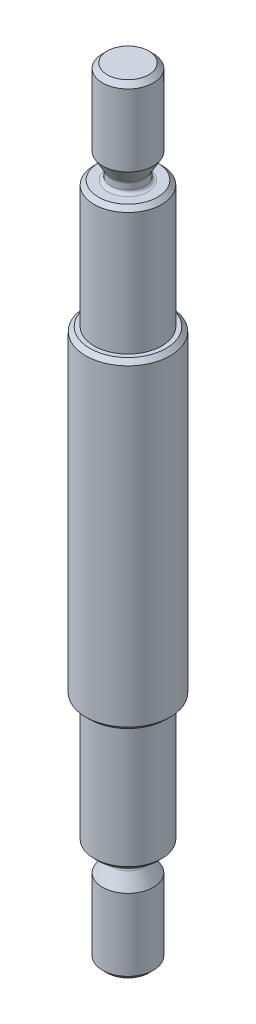
from build123d import *

# Parameters (mm, degrees)
SKETCH1_R           = 5
BOSS_EXTRUDE1_DEPTH = 19
SKETCH2_R           = 4
BOSS_EXTRUDE2_DEPTH = 15
BOSS_EXTRUDE3_START = -53
SKETCH2_2_R         = 4
BOSS_EXTRUDE3_DEPTH = 15
CHAMFER2_SIZE       = 0.5
SKETCH3_R           = 3.1
BOSS_EXTRUDE4_DEPTH = 12
CHAMFER3_SIZE       = 0.5


# Read off the part's stored shape, not the designer's step: M6 Machine Threads Stud1, M6 Machine Threads Stud2
with BuildPart() as part:
    # Sketch1 → Boss-Extrude1 (new, symmetric)
    with BuildSketch(Plane(origin=(0, 0, 0), x_dir=(1, 0, 0), z_dir=(0, 1, 0))):
        with Locations(Location((0, 0, 0), (0, 0, 270))):
            Circle(SKETCH1_R)
    extrude(amount=BOSS_EXTRUDE1_DEPTH, both=True)

    # Sketch2 → Boss-Extrude2 (add)
    with BuildSketch(Plane(origin=(0, 19, 0), x_dir=(1, 0, 0), z_dir=(0, 1, 0))):
        with Locations(Location((0, 0, 0), (0, 0, 270))):
            Circle(SKETCH2_R)
    extrude(amount=BOSS_EXTRUDE2_DEPTH)

    # Sketch2<2> → Boss-Extrude3 (add)
    with BuildSketch(Plane(origin=(0, 19, 0), x_dir=(1, 0, 0), z_dir=(0, 1, 0)).offset(BOSS_EXTRUDE3_START)):
        with Locations(Location((0, 0, 0), (0, 0, 270))):
            Circle(SKETCH2_2_R)
    extrude(amount=BOSS_EXTRUDE3_DEPTH)

    # Chamfer2
    chamfer2_edges = [part.edges().sort_by_distance(p)[0] for p in [
        (0, -19, -5),
        (0, 19, -5),
    ]]
    chamfer(chamfer2_edges, length=CHAMFER2_SIZE)

    # Sketch3 → Boss-Extrude4 (add)
    with BuildSketch(Plane(origin=(0, 34, 0), x_dir=(1, 0, 0), z_dir=(0, 1, 0))):
        with Locations(Location((0, 0, 0), (0, 0, 270))):
            Circle(SKETCH3_R)
    boss_extrude4 = extrude(amount=BOSS_EXTRUDE4_DEPTH)

    # M6 Machine Threads Stud1 outline → M6 Machine Threads Stud1 (revolve, cut)
    with BuildSketch(Plane.XY):
        with BuildLine():
            Line((3.1, 46), (2.4455, 46))
            Line((2.4455, 46), (3, 45.4455))
            Line((3, 45.4455), (3, 36.939230485))
            Line((3, 36.939230485), (2.053589838, 35.3))
            ThreePointArc((2.053589838, 35.3), (2.013629669, 35.203527618), (2, 35.1))
            Line((2, 35.1), (2, 34.4))
            ThreePointArc((2, 34.4), (2.117157288, 34.117157288), (2.4, 34))
            Line((2.4, 34), (3.1, 34))
            Line((3.1, 34), (3.1, 46))
        make_face()
    revolve(axis=Axis((0, 0, 0), (0, 1, 0)), mode=Mode.SUBTRACT)

    # Mirror1: Boss-Extrude4 across plane
    add(boss_extrude4.mirror(Plane.ZX))

    # M6 Machine Threads Stud2 outline → M6 Machine Threads Stud2 (revolve, cut)
    with BuildSketch(Plane.XY):
        with BuildLine():
            Line((2.4455, -46), (3.1, -46))
            Line((3.1, -46), (3.1, -34))
            Line((3.1, -34), (2.4, -34))
            ThreePointArc((2.4, -34), (2.117157288, -34.117157288), (2, -34.4))
            Line((2, -34.4), (2, -35.1))
            ThreePointArc((2, -35.1), (2.013629669, -35.203527618), (2.053589838, -35.3))
            Line((2.053589838, -35.3), (3, -36.939230485))
            Line((3, -36.939230485), (3, -45.4455))
            Line((3, -45.4455), (2.4455, -46))
        make_face()
    revolve(axis=Axis((0, 0, 0), (0, 1, 0)), mode=Mode.SUBTRACT)

    # Chamfer3
    chamfer3_edges = [part.edges().sort_by_distance(p)[0] for p in [
        (0, -34, -4),
        (0, 34, -4),
    ]]
    chamfer(chamfer3_edges, length=CHAMFER3_SIZE)


solid = part.part
